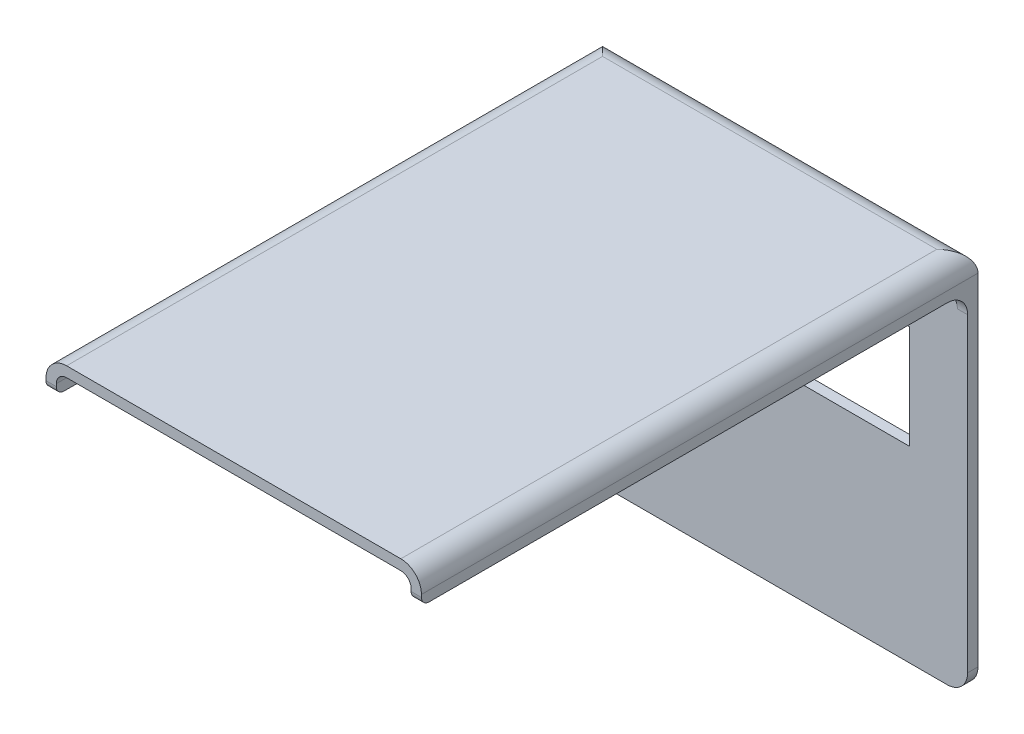
from build123d import *

# Parameters (mm, degrees)
SKETCH1_W            = 68.85
SKETCH1_H            = 107
BOSS_EXTRUDE1_DEPTH  = 2
SKETCH2_W            = 68.85
SKETCH2_H            = 2
BOSS_EXTRUDE2_DEPTH  = 67
CUT_EXTRUDE2_REACH   = 132.855
SKETCH5_W            = 68.85
SKETCH5_H            = 2
BOSS_EXTRUDE3_DEPTH  = 51
SKETCH6_W            = 68.85
SKETCH6_H            = 2
BOSS_EXTRUDE4_DEPTH  = 20.36
BOSS_EXTRUDE5_DEPTH  = 1.5
SKETCH13_W           = 2
SKETCH13_H           = 1.5
BOSS_EXTRUDE8_DEPTH  = 3
CUT_EXTRUDE4_REACH   = 97.75
SKETCH9_R            = 1.75
FILLET1_R            = 1.5
FILLET2_R            = 3
FILLET3_R            = 1.5
FILLET4_R            = 3
CUT_EXTRUDE5_REACH   = 111.975
SKETCH10_R           = 1.75
CHAMFER1_SIZE        = 2
SKETCH11_W           = 2
SKETCH11_H           = 109
BOSS_EXTRUDE6_DEPTH  = 4.5
SKETCH14_W           = 68.85
SKETCH14_H           = 0.5
BOSS_EXTRUDE9_DEPTH  = 2
FILLET5_R            = 2
FILLET6_R            = 4
FILLET8_R            = 4
CUT_EXTRUDE6_DEPTH   = 1
CUT_EXTRUDE7_DEPTH   = 125.986967721
SKETCH17_W           = 68.85
SKETCH17_H           = 2
BOSS_EXTRUDE10_DEPTH = 8.66
SKETCH18_W           = 2
SKETCH18_H           = 68.16
BOSS_EXTRUDE11_DEPTH = 2
SKETCH19_W           = 2
SKETCH19_H           = 68.16
BOSS_EXTRUDE12_DEPTH = 2
FILLET9_R            = 4
FILLET10_R           = 4
FILLET11_R           = 1.5


with BuildPart() as part:
    # Sketch1 → Boss-Extrude1 (new body)
    with BuildSketch(Plane(origin=(0, 0, 0), x_dir=(1, 0, 0), z_dir=(0, 1, 0))):
        Rectangle(SKETCH1_W, SKETCH1_H)
    extrude(amount=BOSS_EXTRUDE1_DEPTH)

    # Sketch2 → Boss-Extrude2 (add)
    with BuildSketch(Plane.XZ):
        with Locations((0, -52.5)):
            Rectangle(SKETCH2_W, SKETCH2_H)
    extrude(amount=BOSS_EXTRUDE2_DEPTH)

    # Sketch4 → Cut-Extrude2 (cut, up to next)
    with BuildSketch(Plane(origin=(0, 0, -53.5), x_dir=(-1, 0, 0), z_dir=(0, 0, -1)), mode=Mode.PRIVATE) as cut_extrude2_sk1:
        Polygon((-6.85, -15.65), (-6.85, -20.95), (-5.325, -20.95), (6.85, -20.95), (6.85, -15.65), (25.15, -15.65), (25.15, -35.75), (-25.15, -35.75), (-25.15, -15.65), align=None)
    cut_extrude2_tool1 = extrude(cut_extrude2_sk1.sketch, amount=-CUT_EXTRUDE2_REACH, mode=Mode.PRIVATE) & part.part
    add(cut_extrude2_tool1.solids().sort_by_distance((0, -26.272573, -53.5))[0], mode=Mode.SUBTRACT)

    # Sketch5 → Boss-Extrude3 (add)
    with BuildSketch(Plane.XY.offset(-51.5)):
        with Locations((0, -66)):
            Rectangle(SKETCH5_W, SKETCH5_H)
    extrude(amount=BOSS_EXTRUDE3_DEPTH)

    # Sketch6 → Boss-Extrude4 (add)
    with BuildSketch(Plane.XZ.offset(67)):
        with Locations((0, -1.5)):
            Rectangle(SKETCH6_W, SKETCH6_H)
    extrude(amount=BOSS_EXTRUDE4_DEPTH)

    # Sketch8 → Boss-Extrude5 (add)
    with BuildSketch(Plane(origin=(0, 2, 0), x_dir=(1, 0, 0), z_dir=(0, 1, 0))):
        Polygon((-36.425, 50.5), (-34.425, 50.5), (-34.425, -53.5), (34.425, -53.5), (34.425, 50.5), (36.425, 50.5), (36.425, -55.5), (-36.425, -55.5), align=None)
    extrude(amount=-BOSS_EXTRUDE5_DEPTH)

    # Sketch13 → Boss-Extrude8 (add)
    with BuildSketch(Plane(origin=(0, 0, -50.5), x_dir=(-1, 0, 0), z_dir=(0, 0, -1))):
        with Locations((35.425, 1.25)):
            Rectangle(SKETCH13_W, SKETCH13_H)
        with Locations((-35.425, 1.25)):
            Rectangle(SKETCH13_W, SKETCH13_H)
    extrude(amount=BOSS_EXTRUDE8_DEPTH)

    # Sketch9 → Cut-Extrude4 (cut, up to next)
    with BuildSketch(Plane.XZ.offset(67), mode=Mode.PRIVATE) as cut_extrude4_sk1:
        with Locations(Location((-25, -23.48, 0), (0, 0, 270))):
            Circle(SKETCH9_R)
    cut_extrude4_tool1 = extrude(cut_extrude4_sk1.sketch, amount=-CUT_EXTRUDE4_REACH, mode=Mode.PRIVATE) & part.part
    # Sketch9 → Cut-Extrude4 (cut, up to next)
    with BuildSketch(Plane.XZ.offset(67), mode=Mode.PRIVATE) as cut_extrude4_sk2:
        with Locations(Location((25, -23.48, 0), (0, 0, 270))):
            Circle(SKETCH9_R)
    cut_extrude4_tool2 = extrude(cut_extrude4_sk2.sketch, amount=-CUT_EXTRUDE4_REACH, mode=Mode.PRIVATE) & part.part
    add(cut_extrude4_tool1.solids().sort_by_distance((-25, -67, -23.48))[0], mode=Mode.SUBTRACT)
    add(cut_extrude4_tool2.solids().sort_by_distance((25, -67, -23.48))[0], mode=Mode.SUBTRACT)

    # Fillet1
    fillet1_edges = [part.edges().sort_by_distance(p)[0] for p in [
        (0, -67, -2.5),
    ]]
    fillet(fillet1_edges, radius=FILLET1_R)

    # Fillet2
    fillet2_edges = [part.edges().sort_by_distance(p)[0] for p in [
        (0, -65, -0.5),
    ]]
    fillet(fillet2_edges, radius=FILLET2_R)

    # Fillet3
    fillet3_edges = [part.edges().sort_by_distance(p)[0] for p in [
        (0, -65, -51.5),
    ]]
    fillet(fillet3_edges, radius=FILLET3_R)

    # Fillet4
    fillet4_edges = [part.edges().sort_by_distance(p)[0] for p in [
        (0, -67, -53.5),
    ]]
    fillet(fillet4_edges, radius=FILLET4_R)

    # Sketch10 → Cut-Extrude5 (cut, up to next)
    with BuildSketch(Plane.XY.offset(-0.5), mode=Mode.PRIVATE) as cut_extrude5_sk1:
        with Locations((-24.425, -79.36)):
            Circle(SKETCH10_R)
    cut_extrude5_tool1 = extrude(cut_extrude5_sk1.sketch, amount=-CUT_EXTRUDE5_REACH, mode=Mode.PRIVATE) & part.part
    # Sketch10 → Cut-Extrude5 (cut, up to next)
    with BuildSketch(Plane.XY.offset(-0.5), mode=Mode.PRIVATE) as cut_extrude5_sk2:
        with Locations((24.425, -79.36)):
            Circle(SKETCH10_R)
    cut_extrude5_tool2 = extrude(cut_extrude5_sk2.sketch, amount=-CUT_EXTRUDE5_REACH, mode=Mode.PRIVATE) & part.part
    add(cut_extrude5_tool1.solids().sort_by_distance((-24.425, -79.36, -0.5))[0], mode=Mode.SUBTRACT)
    add(cut_extrude5_tool2.solids().sort_by_distance((24.425, -79.36, -0.5))[0], mode=Mode.SUBTRACT)

    # Chamfer1
    chamfer1_edges = [part.edges().sort_by_distance(p)[0] for p in [
        (-34.425, -87.36, -1.5),
        (34.425, -87.36, -1.5),
    ]]
    chamfer(chamfer1_edges, length=CHAMFER1_SIZE)

    # Sketch11 → Boss-Extrude6 (add)
    with BuildSketch(Plane.XZ.offset(-0.5)):
        with Locations((35.425, 1)):
            Rectangle(SKETCH11_W, SKETCH11_H)
        with Locations((-35.425, 1)):
            Rectangle(SKETCH11_W, SKETCH11_H)
    extrude(amount=BOSS_EXTRUDE6_DEPTH)

    # Sketch14 → Boss-Extrude9 (add)
    with BuildSketch(Plane.XY.offset(53.5)):
        with Locations((0, 0.25)):
            Rectangle(SKETCH14_W, SKETCH14_H)
    extrude(amount=BOSS_EXTRUDE9_DEPTH)

    # Fillet5
    fillet5_edges = [part.edges().sort_by_distance(p)[0] for p in [
        (0, 0, -51.5),
        (34.425, 0, 2),
        (-34.425, 0, 2),
    ]]
    fillet(fillet5_edges, radius=FILLET5_R)

    # Fillet6
    fillet6_edges = [part.edges().sort_by_distance(p)[0] for p in [
        (0, 2, -53.5),
    ]]
    fillet(fillet6_edges, radius=FILLET6_R)

    # Fillet8
    # the kernel refuses this fillet: 4 mm, written as the material it takes off along each edge
    with BuildSketch(Plane(origin=(-36.425, 2, 65.5), x_dir=(1, 0, 0), z_dir=(0, 0, -1))) as fillet8_piece_1:
        with BuildLine():
            CenterArc((FILLET8_R, FILLET8_R), FILLET8_R, 180, 90)
            Line((0, FILLET8_R), (0, 0))
            Line((0, 0), (FILLET8_R, 0))
        make_face()
    extrude(amount=125, mode=Mode.SUBTRACT)
    with BuildSketch(Plane(origin=(36.425, 2, -59.5), x_dir=(0, -1, 0), z_dir=(0, 0, 1))) as fillet8_piece_2:
        with BuildLine():
            CenterArc((FILLET8_R, -FILLET8_R), FILLET8_R, 90, 90)
            Line((0, -FILLET8_R), (0, 0))
            Line((0, 0), (FILLET8_R, 0))
        make_face()
    extrude(amount=125, mode=Mode.SUBTRACT)

    # Sketch15 → Cut-Extrude6 (cut)
    with BuildSketch(Plane.XY.offset(55.5)):
        with BuildLine():
            Line((-36.425, -2), (-36.425, -4))
            Line((-36.425, -4), (-34.425, -4))
            Line((-34.425, -4), (-34.425, -2))
            ThreePointArc((-34.425, -2), (-33.839213562, -0.585786438), (-32.425, 0))
            Line((-32.425, 0), (32.425, 0))
            ThreePointArc((32.425, 0), (33.839213562, -0.585786438), (34.425, -2))
            Line((34.425, -2), (34.425, -4))
            Line((34.425, -4), (36.425, -4))
            Line((36.425, -4), (36.425, -2))
            ThreePointArc((36.425, -2), (35.253427125, 0.828427125), (32.425, 2))
            Line((32.425, 2), (-32.425, 2))
            ThreePointArc((-32.425, 2), (-35.253427125, 0.828427125), (-36.425, -2))
        make_face()
    extrude(amount=-CUT_EXTRUDE6_DEPTH, mode=Mode.SUBTRACT)

    # Sketch16 → Cut-Extrude7 (cut, through all)
    with BuildSketch(Plane(origin=(34.425, 0, 0), x_dir=(0, 0, -1), z_dir=(1, 0, 0))):
        with BuildLine():
            Line((2.5, -87.36), (0.5, -87.36))
            Line((0.5, -87.36), (0.5, -68))
            ThreePointArc((0.5, -68), (1.378679656, -65.878679656), (3.5, -65))
            Line((3.5, -65), (50, -65))
            ThreePointArc((50, -65), (51.060660172, -64.560660172), (51.5, -63.5))
            Line((51.5, -63.5), (53.5, -63.5))
            Line((53.5, -63.5), (53.5, -64))
            ThreePointArc((53.5, -64), (52.621320344, -66.121320344), (50.5, -67))
            Line((50.5, -67), (4, -67))
            ThreePointArc((4, -67), (2.939339828, -67.439339828), (2.5, -68.5))
            Line((2.5, -68.5), (2.5, -87.36))
        make_face()
    extrude(amount=-CUT_EXTRUDE7_DEPTH, mode=Mode.SUBTRACT)

    # Sketch17 → Boss-Extrude10 (add)
    with BuildSketch(Plane.XZ.offset(63.5)):
        with Locations((0, -52.5)):
            Rectangle(SKETCH17_W, SKETCH17_H)
    extrude(amount=BOSS_EXTRUDE10_DEPTH)

    # Sketch18 → Boss-Extrude11 (add)
    with BuildSketch(Plane(origin=(34.425, 0, 0), x_dir=(0, 0, -1), z_dir=(1, 0, 0))):
        with Locations((52.5, -38.08)):
            Rectangle(SKETCH18_W, SKETCH18_H)
    extrude(amount=BOSS_EXTRUDE11_DEPTH)

    # Sketch19 → Boss-Extrude12 (add)
    with BuildSketch(Plane.ZY.offset(34.425)):
        with Locations((-52.5, -38.08)):
            Rectangle(SKETCH19_W, SKETCH19_H)
    extrude(amount=BOSS_EXTRUDE12_DEPTH)

    # Fillet9
    fillet9_edges = [part.edges().sort_by_distance(p)[0] for p in [
        (36.425, -72.16, -52.5),
        (-36.425, -72.16, -52.5),
    ]]
    fillet(fillet9_edges, radius=FILLET9_R)

    # Fillet10
    fillet10_edges = [part.edges().sort_by_distance(p)[0] for p in [
        (35.425, -4, -51.5),
        (-35.425, -4, -51.5),
    ]]
    fillet(fillet10_edges, radius=FILLET10_R)

    # Fillet11
    fillet11_edges = [part.edges().sort_by_distance(p)[0] for p in [
        (35.425, -4, 54.5),
        (-35.425, -4, 54.5),
    ]]
    fillet(fillet11_edges, radius=FILLET11_R)


solid = part.part
